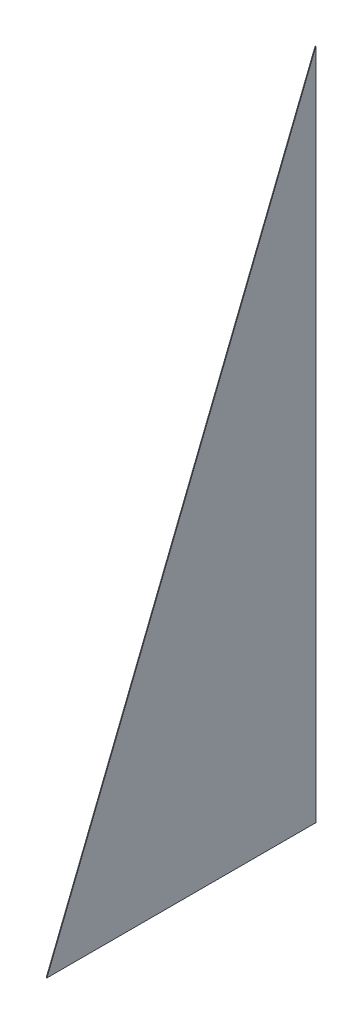
from build123d import *

# Parameters (mm, degrees)
BOSS_EXTRUDE1_DEPTH = 1


with BuildPart() as part:
    # Sketch1 → Boss-Extrude1 (new body)
    with BuildSketch(Plane(origin=(0, 0, 0), x_dir=(0, 0, -1), z_dir=(1, 0, 0))):
        Polygon((0, 0), (0, 1000), (-400, 0), align=None)
    extrude(amount=BOSS_EXTRUDE1_DEPTH)


solid = part.part
